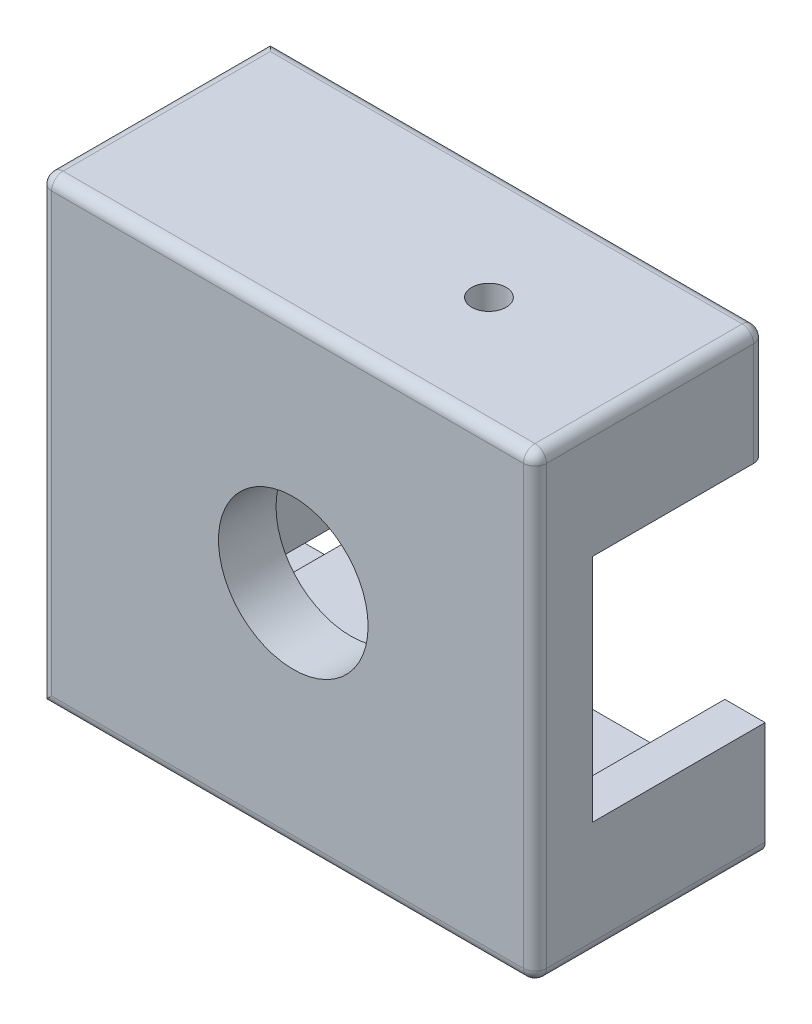
from build123d import *

# Parameters (mm, degrees)
SKETCH1_W           = 43
SKETCH1_H           = 40
BOSS_EXTRUDE1_DEPTH = 5
SKETCH2_W           = 13
SKETCH2_H           = 2
SKETCH2_W_2         = 17.5
SKETCH2_W_3         = 2.5
SKETCH2_H_2         = 10
BOSS_EXTRUDE3_DEPTH = 8
BOSS_EXTRUDE4_DEPTH = 15
SKETCH4_R           = 1.5
CUT_EXTRUDE1_DEPTH  = 65
SKETCH6_R           = 1.5
CUT_EXTRUDE2_DEPTH  = 10
SKETCH7_R           = 6.5
CUT_EXTRUDE3_DEPTH  = 20
SKETCH8_W           = 15
SKETCH8_H           = 20
CUT_EXTRUDE4_DEPTH  = 5
FILLET1_R           = 1


with BuildPart() as part:
    # Sketch1 → Boss-Extrude1 (new body)
    with BuildSketch(Plane.XY):
        with Locations((75.504805995, -8.785410368)):
            Rectangle(SKETCH1_W, SKETCH1_H)
    extrude(amount=BOSS_EXTRUDE1_DEPTH)

    # Sketch2 → Boss-Extrude3 (add)
    with BuildSketch(Plane(origin=(0, 0, 0), x_dir=(-1, 0, 0), z_dir=(0, 0, -1))):
        with Locations((-79.004805995, -0.485410368)):
            Rectangle(SKETCH2_W, SKETCH2_H)
        with Locations((-76.754805995, -16.985410368)):
            Rectangle(SKETCH2_W_2, SKETCH2_H)
        with Locations((-66.754805995, -9.285410368)):
            Rectangle(SKETCH2_W_3, SKETCH2_H_2)
    extrude(amount=BOSS_EXTRUDE3_DEPTH)

    # Sketch3 → Boss-Extrude4 (add)
    with BuildSketch(Plane(origin=(0, 0, 0), x_dir=(-1, 0, 0), z_dir=(0, 0, -1))):
        Polygon((-54.004805995, 11.214589632), (-97.004805995, 11.214589632), (-97.004805995, -28.785410368), (-54.004805995, -28.785410368), (-54.004805995, -25.285410368), (-93.504805995, -25.285410368), (-93.504805995, 7.714589632), (-54.004805995, 7.714589632), align=None)
    extrude(amount=BOSS_EXTRUDE4_DEPTH)

    # Sketch4 → Cut-Extrude1 (cut)
    with BuildSketch(Plane(origin=(0, 11.214589632, 0), x_dir=(1, 0, 0), z_dir=(0, 1, 0))):
        with Locations((83.004805995, 5)):
            Circle(SKETCH4_R)
    extrude(amount=-CUT_EXTRUDE1_DEPTH, mode=Mode.SUBTRACT)

    # Sketch6 → Cut-Extrude2 (cut)
    with BuildSketch(Plane.XZ.offset(28.785410368)):
        with Locations((60.004805995, -5)):
            Circle(SKETCH6_R)
    extrude(amount=-CUT_EXTRUDE2_DEPTH, mode=Mode.SUBTRACT)

    # Sketch7 → Cut-Extrude3 (cut)
    with BuildSketch(Plane.XY.offset(5)):
        with Locations((76.004805995, -8.785410368)):
            Circle(SKETCH7_R)
    extrude(amount=-CUT_EXTRUDE3_DEPTH, mode=Mode.SUBTRACT)

    # Sketch8 → Cut-Extrude4 (cut)
    with BuildSketch(Plane(origin=(97.004805995, 0, 0), x_dir=(0, 0, -1), z_dir=(1, 0, 0))):
        with Locations((7.5, -8.785410368)):
            Rectangle(SKETCH8_W, SKETCH8_H)
    extrude(amount=-CUT_EXTRUDE4_DEPTH, mode=Mode.SUBTRACT)

    # Fillet1
    fillet1_edges = [part.edges().sort_by_distance(p)[0] for p in [
        (54.004805995, 11.214589632, -5),
        (54.004805995, -8.785410368, 5),
        (75.504805995, -28.785410368, 5),
        (97.004805995, -28.785410368, -5),
        (97.004805995, -8.785410368, 5),
        (75.504805995, 11.214589632, 5),
        (97.004805995, 11.214589632, -5),
        (97.004805995, 6.214589632, -15),
        (75.504805995, 11.214589632, -15),
    ]]
    fillet(fillet1_edges, radius=FILLET1_R)


solid = part.part
